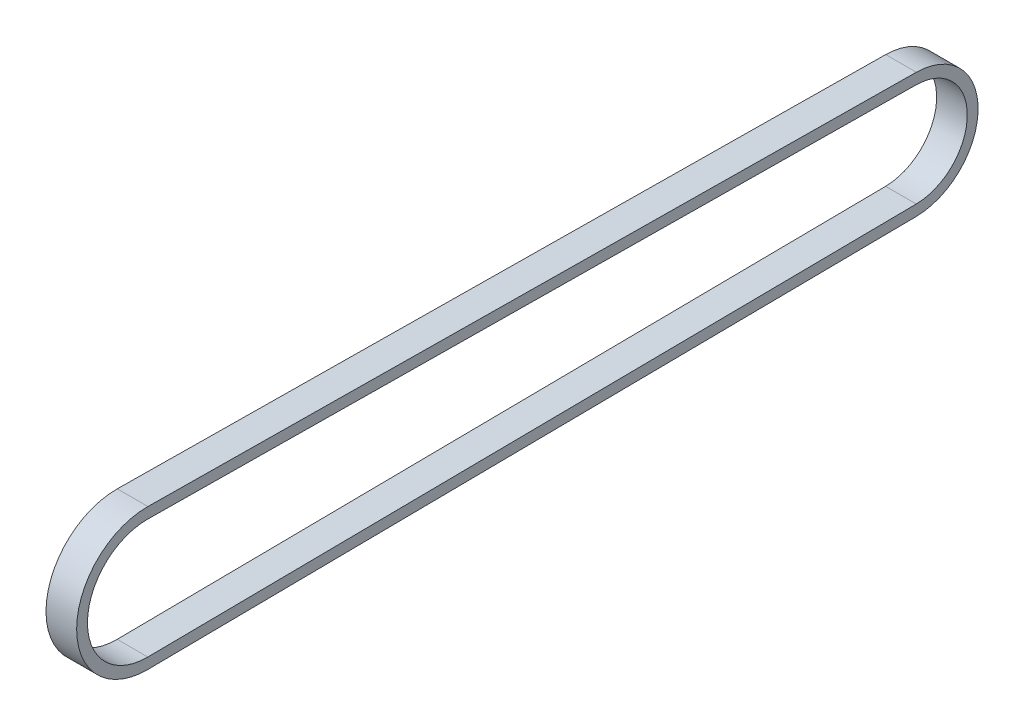
from build123d import *

# Parameters (mm, degrees)
BOSS_EXTRUDE1_DEPTH = 4.5


with BuildPart() as part:
    # Sketch1 → Boss-Extrude1 (new, symmetric)
    with BuildSketch(Plane(origin=(0, 0, 0), x_dir=(0, 0, -1), z_dir=(1, 0, 0))):
        with BuildLine():
            Line((0.218960815, 20.722703237), (225.931181133, 18.337776366))
            ThreePointArc((225.931181133, 18.337776366), (244.07622, 0), (225.931181133, -18.337776366))
            Line((225.931181133, -18.337776366), (0.218960815, -20.722703237))
            ThreePointArc((0.218960815, -20.722703237), (-20.72386, 0), (0.218960815, 20.722703237))
        make_face()
        with BuildLine():
            Line((0.185414913, 17.547880459), (225.897635231, 15.162953588))
            ThreePointArc((225.897635231, 15.162953588), (240.90122, 0), (225.897635231, -15.162953588))
            Line((225.897635231, -15.162953588), (0.185414913, -17.547880459))
            ThreePointArc((0.185414913, -17.547880459), (-17.54886, 0), (0.185414913, 17.547880459))
        make_face(mode=Mode.SUBTRACT)
    extrude(amount=BOSS_EXTRUDE1_DEPTH, both=True)


solid = part.part
